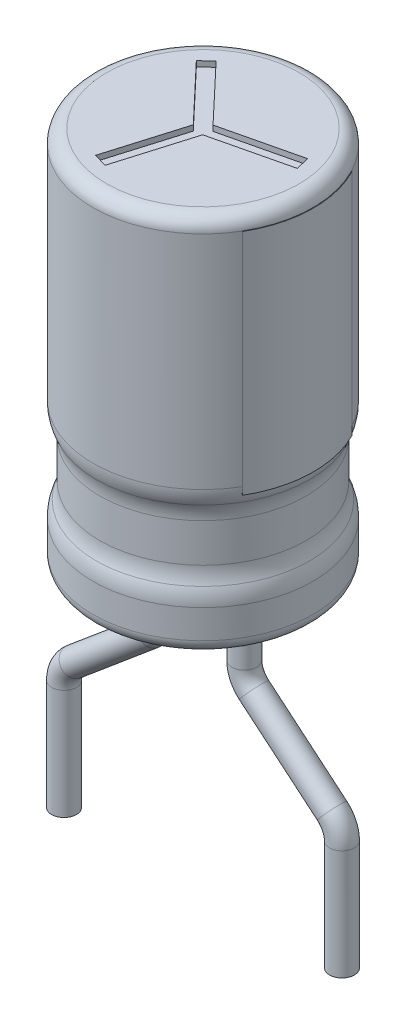
from build123d import *

# Parameters (mm, degrees)
SKETCH1_R               = 2
EXTRUDE1_DEPTH          = 7
SKETCH2_R               = 3.5
CUT_EXTRUDE1_DEPTH      = 0.1
FILLET1_R               = 0.25
CUT_EXTRUDE2_DEPTH      = 0.75
CUT_EXTRUDE2_DEPTH_BACK = 0.75
SKETCH3_OUTSIDE_W       = 7.784
SKETCH3_OUTSIDE_H       = 7.784
SKETCH3_OUTSIDE_R       = 1.875
FILLET2_R               = 0.7
FILLET3_R               = 0.7
CUT_EXTRUDE_THIN2_DEPTH = 0.1
CUT_EXTRUDE_THIN3_DEPTH = 0.1
CUT_EXTRUDE_THIN4_DEPTH = 0.1
SKETCH5_R               = 0.225
EXTRUDE2_DEPTH          = 0.77
BOSS_EXTRUDE1_DEPTH     = 4.15
SKETCH9_R               = 0.225


with BuildPart() as part:
    # Sketch1 → Extrude1 (new body)
    with BuildSketch(Plane(origin=(0, 0, 0), x_dir=(1, 0, 0), z_dir=(0, 1, 0))):
        with Locations(Location((0, 0, 0), (0, 0, 270))):
            Circle(SKETCH1_R)
    extrude(amount=EXTRUDE1_DEPTH)

    # Sketch2 → Cut-Extrude1 (cut)
    with BuildSketch(Plane(origin=(0, 7, 0), x_dir=(-1, 0, 0), z_dir=(0, 1, 0))):
        Circle(SKETCH2_R)
    extrude(amount=-CUT_EXTRUDE1_DEPTH, mode=Mode.SUBTRACT)

    # Fillet1
    fillet1_edges = [part.edges().sort_by_distance(p)[0] for p in [
        (0, 0, -2),
        (0, 6.9, -2),
    ]]
    fillet(fillet1_edges, radius=FILLET1_R)

    # Sketch3 outside → Cut-Extrude2 (cut, two sides: drawn at the far end of the back side and taken through both)
    with BuildSketch(Plane(origin=(0, 1.7, 0), x_dir=(-1, 0, 0), z_dir=(0, 1, 0)).offset(-CUT_EXTRUDE2_DEPTH_BACK)):
        Rectangle(SKETCH3_OUTSIDE_W, SKETCH3_OUTSIDE_H)
        with Locations(Location((0, 0, 0), (0, 0, 90))):
            Circle(SKETCH3_OUTSIDE_R, mode=Mode.SUBTRACT)
    extrude(amount=CUT_EXTRUDE2_DEPTH + CUT_EXTRUDE2_DEPTH_BACK, mode=Mode.SUBTRACT)

    # Fillet2
    # the kernel refuses this fillet: 0.7 mm, written as the material it adds along each edge
    with BuildSketch(Plane(origin=(0, 0.95, 0), x_dir=(0, 0, 1), z_dir=(-1, 0, 0))) as fillet2_piece_1:
        with BuildLine():
            CenterArc((2.575, 0.399217986), FILLET2_R, 180, 34.771944032)
            Line((1.875, 0.399217986), (1.861, 0.399217986))
            Line((1.861, 0.399217986), (1.861, 0))
            Line((1.861, 0), (1.875, -0.014))
            ThreePointArc((1.875, -0.014), (1.9375, -0.014), (1.9885, -0.00798436))
            Line((1.9885, -0.00798436), (2, 0))
        make_face()
    revolve(axis=Axis((0, 0.95, 0), (0, 1, 0)))
    with BuildSketch(Plane(origin=(0, 2.45, 0), x_dir=(0, 0, 1), z_dir=(-1, 0, 0))) as fillet2_piece_2:
        with BuildLine():
            CenterArc((2.575, -0.399217986), FILLET2_R, 145.228055968, 34.771944032)
            Line((2, 0), (1.9885, 0.00798436))
            ThreePointArc((1.9885, 0.00798436), (1.9375, 0.014), (1.875, 0.014))
            Line((1.875, 0.014), (1.861, 0))
            Line((1.861, 0), (1.861, -0.399217986))
            Line((1.861, -0.399217986), (1.875, -0.399217986))
        make_face()
    revolve(axis=Axis((0, 2.45, 0), (0, 1, 0)))

    # Fillet3
    fillet3_edges = [part.edges().sort_by_distance(p)[0] for p in [
        (0, 2.45, -2),
        (0, 0.95, -2),
    ]]
    fillet(fillet3_edges, radius=FILLET3_R)

    # Sketch4 → Cut-Extrude-Thin2 (cut)
    with BuildSketch(Plane(origin=(0, 6.9, 0), x_dir=(-1, 0, 0), z_dir=(0, 1, 0))):
        Polygon((-0.092250351, -0.087286155), (0.938688485, -1.176857225), (1.123189186, -1.002284916), (0.092250351, 0.087286155), align=None)
    extrude(amount=-CUT_EXTRUDE_THIN2_DEPTH, mode=Mode.SUBTRACT)

    # Sketch4<3> → Cut-Extrude-Thin3 (cut)
    with BuildSketch(Plane(origin=(0, 6.9, 0), x_dir=(-1, 0, 0), z_dir=(0, 1, 0))):
        Polygon((-0.029466852, 0.123534225), (-1.488532496, -0.224499462), (-1.429598792, -0.471567911), (0.029466852, -0.123534225), align=None)
    extrude(amount=-CUT_EXTRUDE_THIN3_DEPTH, mode=Mode.SUBTRACT)

    # Sketch4<4> → Cut-Extrude-Thin4 (cut)
    with BuildSketch(Plane(origin=(0, 6.9, 0), x_dir=(-1, 0, 0), z_dir=(0, 1, 0))):
        Polygon((0.121717203, -0.03624807), (0.549844011, 1.401356687), (0.306409606, 1.473852826), (-0.121717203, 0.03624807), align=None)
    extrude(amount=-CUT_EXTRUDE_THIN4_DEPTH, mode=Mode.SUBTRACT)

    # Sketch5 → Extrude2 (add)
    with BuildSketch(Plane.XZ):
        with Locations(Location((-0.75, 0, 0), (0, 0, 90))):
            Circle(SKETCH5_R)
        with Locations(Location((0.75, 0, 0), (0, 0, 90))):
            Circle(SKETCH5_R)
    extrude(amount=EXTRUDE2_DEPTH)

    # Sketch6 → Boss-Extrude1 (add)
    with BuildSketch(Plane(origin=(0, 2.5, 0), x_dir=(1, 0, 0), z_dir=(0, 1, 0))):
        with BuildLine():
            Line((1.760645763, 0.905829177), (1.787322214, 0.919553862))
            ThreePointArc((1.787322214, 0.919553862), (2.009258531, -0.054590818), (1.734754372, -1.015247393))
            Line((1.734754372, -1.015247393), (1.708862516, -1.000094447))
            ThreePointArc((1.708862516, -1.000094447), (1.979269597, -0.05377603), (1.760645763, 0.905829177))
        make_face()
    extrude(amount=BOSS_EXTRUDE1_DEPTH)

    # Sweep2: sweep along a path in Sketch8
    with BuildLine(Plane(origin=(0, -2, 0), x_dir=(1, 0, 0), z_dir=(0, 0, -1))) as sweep2_path:
        Line((2.52439461, 3.047935202), (2.52439461, 1.047935202))
        ThreePointArc((2.52439461, 1.047935202), (2.477548504, 0.836626071), (2.345788415, 0.66491298))
        Line((2.345788415, 0.66491298), (0.928606195, -0.524244097))
        ThreePointArc((0.928606195, -0.524244097), (0.796846106, -0.695957188), (0.75, -0.907266319))
        Line((0.75, -0.907266319), (0.75, -1.23))
    # Sketch9 → Sweep2 (sweep)
    with BuildSketch(Plane(origin=(0, -0.77, -4.656884625), x_dir=(1, 0, 0), z_dir=(0, 1, 0))):
        with Locations((0.75, -4.656884625)):
            Circle(SKETCH9_R)
    sweep2 = sweep(path=sweep2_path.line)

    # Mirror1: Sweep2 across plane
    add(sweep2.mirror(Plane(origin=(0, 0, 0), x_dir=(0, 0, 1), z_dir=(1, 0, 0))))


solid = part.part
